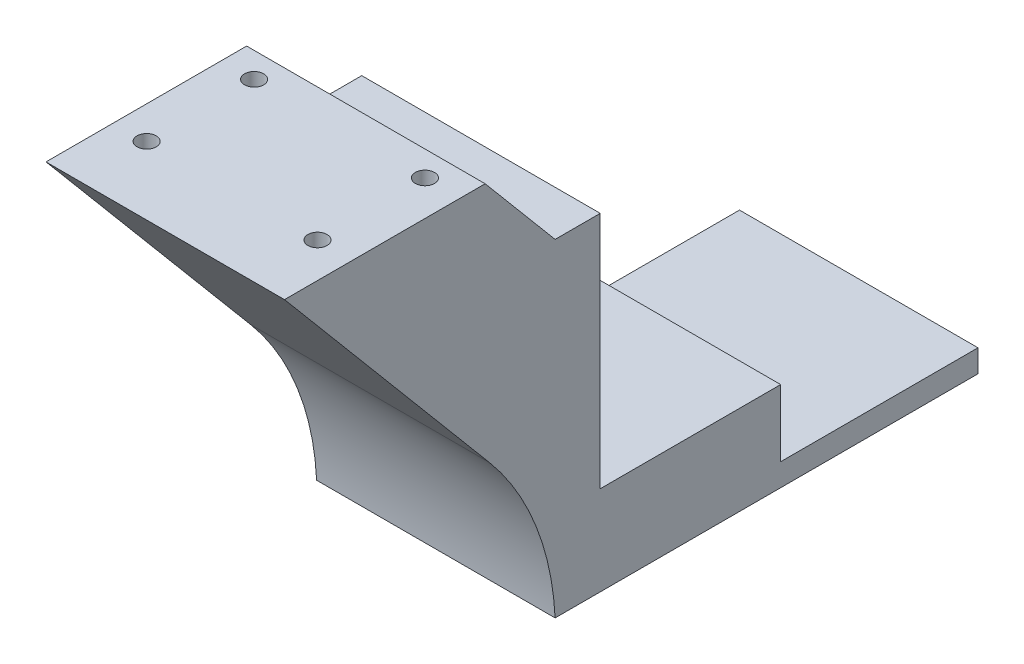
from build123d import *

# Parameters (mm, degrees)
SCHIZZO1_W                   = 42.3
SCHIZZO1_H                   = 42.3
ESTRUSIONE_ESTRUSIONE1_DEPTH = 6
FORO_PER_VITE_M3_1_OUTLINE_R = 1.7
FORO_PER_VITE_M3_1_DEPTH     = 6
ESTRUSIONE_ESTRUSIONE2_DEPTH = 42.3
ESTRUSIONE_ESTRUSIONE4_DEPTH = 42.3
RACCORDO1_R                  = 50


# Read off the part's stored shape, not the designer's step: Foro per Vite M3-1, Foro per Vite M3-2
with BuildPart() as part:
    # Schizzo1 → Estrusione-Estrusione1 (new body)
    with BuildSketch(Plane.XY):
        with Locations((-21.15, 21.15)):
            Rectangle(SCHIZZO1_W, SCHIZZO1_H)
    extrude(amount=ESTRUSIONE_ESTRUSIONE1_DEPTH)

    # Foro per Vite M3-1 outline → Foro per Vite M3-1 (cut)
    with BuildSketch(Plane.XY):
        with Locations((-5.65, 36.65)):
            Circle(FORO_PER_VITE_M3_1_OUTLINE_R)
        with Locations((-36.65, 5.65)):
            Circle(FORO_PER_VITE_M3_1_OUTLINE_R)
        with Locations((-5.65, 5.65)):
            Circle(FORO_PER_VITE_M3_1_OUTLINE_R)
        with Locations((-36.65, 36.65)):
            Circle(FORO_PER_VITE_M3_1_OUTLINE_R)
    extrude(amount=FORO_PER_VITE_M3_1_DEPTH, mode=Mode.SUBTRACT)

    # Schizzo4 → Estrusione-Estrusione2 (add)
    with BuildSketch(Plane.ZY.offset(42.3)):
        Polygon((6, 0), (8, 0), (56, 57.05), (20.410166521, 57.05), (8, 42.3), (6, 42.3), align=None)
    extrude(amount=-ESTRUSIONE_ESTRUSIONE2_DEPTH)

    # Foro per Vite M3-2 outline → Foro per Vite M3-2 (revolve, cut)
    with BuildSketch(Plane(origin=(-6.23, 0, 24.860166521), x_dir=(1, 0, 0), z_dir=(0, 0, 1))):
        Polygon((0, 57.05), (0, 52.028536948), (1.7, 53.05), (1.7, 57.05), align=None)
    revolve(axis=Axis((-6.23, 0, 24.860166521), (0, 1, 0)), mode=Mode.SUBTRACT)

    # Foro per Vite M3-2 2 outline → Foro per Vite M3-2 2 (revolve, cut)
    with BuildSketch(Plane(origin=(-36.53, 0, 43.920166521), x_dir=(1, 0, 0), z_dir=(0, 0, 1))):
        Polygon((0, 57.05), (0, 52.028536948), (1.7, 53.05), (1.7, 57.05), align=None)
    revolve(axis=Axis((-36.53, 0, 43.920166521), (0, 1, 0)), mode=Mode.SUBTRACT)

    # Foro per Vite M3-2 3 outline → Foro per Vite M3-2 3 (revolve, cut)
    with BuildSketch(Plane(origin=(-6.23, 0, 43.920166521), x_dir=(1, 0, 0), z_dir=(0, 0, 1))):
        Polygon((0, 57.05), (0, 52.028536948), (1.7, 53.05), (1.7, 57.05), align=None)
    revolve(axis=Axis((-6.23, 0, 43.920166521), (0, 1, 0)), mode=Mode.SUBTRACT)

    # Foro per Vite M3-2 4 outline → Foro per Vite M3-2 4 (revolve, cut)
    with BuildSketch(Plane(origin=(-36.53, 0, 24.860166521), x_dir=(1, 0, 0), z_dir=(0, 0, 1))):
        Polygon((0, 57.05), (0, 52.028536948), (1.7, 53.05), (1.7, 57.05), align=None)
    revolve(axis=Axis((-36.53, 0, 24.860166521), (0, 1, 0)), mode=Mode.SUBTRACT)

    # Schizzo8 → Estrusione-Estrusione4 (add)
    with BuildSketch(Plane(origin=(0, 0, 0), x_dir=(0, 0, -1), z_dir=(1, 0, 0))):
        Polygon((-8, -15.85), (67, -15.85), (67, -11.85), (32, -11.85), (32, 0), (-8, 0), align=None)
    extrude(amount=-ESTRUSIONE_ESTRUSIONE4_DEPTH)

    # Raccordo1
    # the kernel refuses this fillet: 50 mm, written as the material it adds along each edge
    with BuildSketch(Plane(origin=(-42.3, 0, 8), x_dir=(0, 0.7651893786180985, 0.6438052615892854), z_dir=(1, 0, 0))) as raccordo1_piece_1:
        with BuildLine():
            CenterArc((18.14225095, 50), RACCORDO1_R, 232.741645316, 37.258354684)
            Line((-12.128251651, 10.204313396), (-12.733661703, 9.408399664))
            ThreePointArc((-12.733661703, 9.408399664), (-6.707931087, 4.336967319), (-0.643805262, -0.765189379))
            Line((-0.643805262, -0.765189379), (0, -1))
            Line((0, -1), (18.14225095, -1))
            Line((18.14225095, -1), (18.14225095, 0))
        make_face()
    extrude(amount=42.3)


solid = part.part
